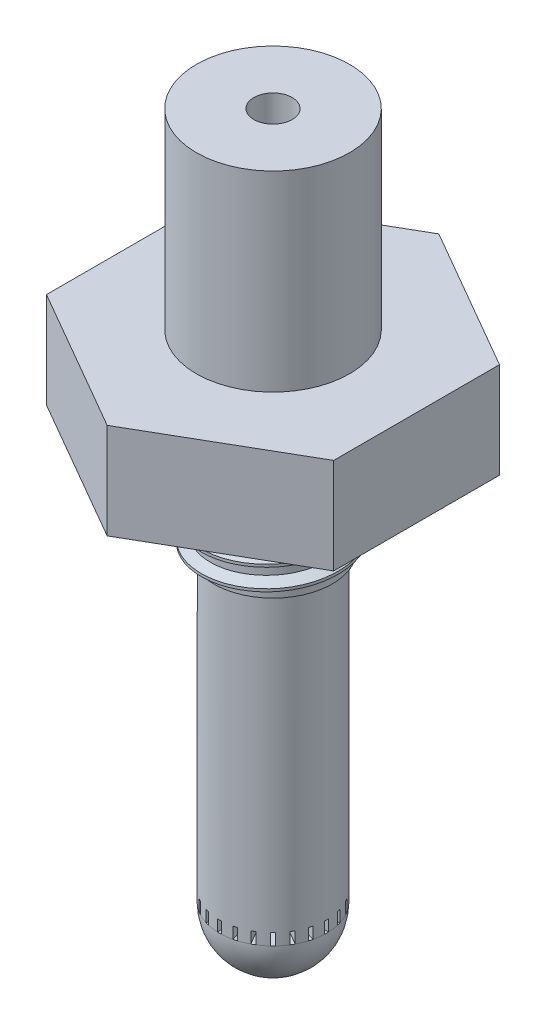
from build123d import *
from build123d.topology import SkipClean

# Parameters (mm, degrees)
CUT_EXTRUDE1_REACH  = 21.844
SKETCH2_W           = 0.254
SKETCH2_H           = 0.762
CIRPATTERN1_COUNT   = 24
BOSS_EXTRUDE1_START = -6.29158
SKETCH3_R           = 3.937
SKETCH3_R_2         = 1.27
BOSS_EXTRUDE1_DEPTH = 6.29158
BOSS_EXTRUDE2_START = 6.35
SKETCH4_R           = 1.27
BOSS_EXTRUDE2_DEPTH = 6.35
BOSS_EXTRUDE3_START = 12.7
SKETCH6_R           = 5.08
SKETCH6_R_2         = 1.27
BOSS_EXTRUDE3_DEPTH = 12.7
SWEEP1_PITCH        = 1.411111224
SKETCH9_W           = 5.029134959
SKETCH9_H           = 1.433756006


with BuildPart() as part:
    # Sketch1 → Revolve2 (revolve)
    with BuildSketch(Plane.XY, mode=Mode.PRIVATE) as revolve2_sk:
        with BuildLine():
            Line((-1.27, 18.181654136), (-3.556, 18.181654136))
            Line((-3.556, 18.181654136), (-3.556, -2.067225864))
            ThreePointArc((-3.556, -2.067225864), (-2.514471714, -4.581697578), (0, -5.623225864))
            Line((0, -5.623225864), (0, -1.606607061))
            ThreePointArc((0, -1.606607061), (-0.600006341, -1.9333996), (-1.27, -2.067225864))
            Line((-1.27, -2.067225864), (-1.27, 18.181654136))
        make_face()
    revolve(revolve2_sk.sketch.rotate(Axis((0, 8.215698649, 0), (0, -1, 0)), 270), axis=Axis((0, 8.215698649, 0), (0, -1, 0)))

    # Sketch2 → Cut-Extrude1 (cut, up to next)
    with BuildSketch(Plane.ZY.offset(3.556), mode=Mode.PRIVATE) as cut_extrude1_sk1:
        with Locations((0, -1.686225864)):
            Rectangle(SKETCH2_W, SKETCH2_H)
    cut_extrude1_tool1 = extrude(cut_extrude1_sk1.sketch, amount=-CUT_EXTRUDE1_REACH, mode=Mode.PRIVATE) & part.part
    cut_extrude1 = cut_extrude1_tool1.solids().sort_by_distance((-3.556, -1.686226, 0))[0]
    add(cut_extrude1, mode=Mode.SUBTRACT)

    # CirPattern1: Cut-Extrude1 ×24 about axis
    cirpattern1_axis = Axis((0, 0, 0), (0, 1, 0))
    for i in range(1, CIRPATTERN1_COUNT):
        add(cut_extrude1.rotate(cirpattern1_axis, i * 360 / CIRPATTERN1_COUNT), mode=Mode.SUBTRACT)

    # Sketch3 → Boss-Extrude1 (add)
    with BuildSketch(Plane(origin=(0, 18.181654136, 0), x_dir=(-1, 0, 0), z_dir=(0, -1, 0)).offset(BOSS_EXTRUDE1_START)):
        with Locations(Location((0, 0, 0), (0, 0, 90))):
            Circle(SKETCH3_R)
        with Locations(Location((0, 0, 0), (0, 0, 275.739170477))):
            Circle(SKETCH3_R_2, mode=Mode.SUBTRACT)
    extrude(amount=BOSS_EXTRUDE1_DEPTH)

    # Sketch4 → Boss-Extrude2 (add)
    with SkipClean():  # the faces are left unmerged after this step: merging them gives an invalid solid
        with BuildSketch(Plane(origin=(0, 24.473234136, 0), x_dir=(1, 0, 0), z_dir=(0, 1, 0)).offset(BOSS_EXTRUDE2_START)):
            Polygon((-9.525, 5.499261314), (-9.525, -5.499261314), (0, -10.998522628), (9.525, -5.499261314), (9.525, 5.499261314), (0, 10.998522628), align=None)
            with Locations(Location((0, 0, 0), (0, 0, 270))):
                Circle(SKETCH4_R, mode=Mode.SUBTRACT)
        extrude(amount=-BOSS_EXTRUDE2_DEPTH)

    # Sketch6 → Boss-Extrude3 (add)
    with BuildSketch(Plane(origin=(0, 30.823234136, 0), x_dir=(1, 0, 0), z_dir=(0, 1, 0)).offset(BOSS_EXTRUDE3_START)):
        with Locations(Location((0, 0, 0), (0, 0, 270))):
            Circle(SKETCH6_R)
        with Locations(Location((0, 0, 0), (0, 0, 270))):
            Circle(SKETCH6_R_2, mode=Mode.SUBTRACT)
    extrude(amount=-BOSS_EXTRUDE3_DEPTH)

    # Sweep1: the profile of Sketch8 profile screwed along a right-hand helix of 5 turns, 8 arcs to a turn; built about Z, then put on its axis
    sweep1_z = Axis((0, 0, 0), (0, 0, 1))
    sweep1_corners = [(3.9367, 0, -0.436648555), (3.9367, 0, 0.436648555), (4.54025, 0, 0.0881888), (4.54025, 0, -0.0881888)]
    with BuildLine(mode=Mode.PRIVATE) as sweep1_profile:
        Line(sweep1_corners[0], sweep1_corners[1])
        Line(sweep1_corners[1], sweep1_corners[2])
        Line(sweep1_corners[2], sweep1_corners[3])
        Line(sweep1_corners[3], sweep1_corners[0])
    sweep1_cap = Face(sweep1_profile.wire())
    sweep1_turn_angles = [0, 22.5, 45, 67.5, 90, 112.5, 135, 157.5, 180, 202.5, 225, 247.5, 270, 292.5, 315, 337.5, 360]
    sweep1_turn_weights = [1, 0.9238795325112867, 1, 0.9238795325112867, 1, 0.9238795325112867, 1, 0.9238795325112867, 1, 0.9238795325112867, 1, 0.9238795325112867, 1, 0.9238795325112867, 1, 0.9238795325112867, 1]
    sweep1_turn_rails = [Edge.make_bspline([Vector(p[0], p[1], 0).rotate(sweep1_z, sweep1_turn_angles[k]) / sweep1_turn_weights[k] + Vector(0, 0, p[2] + SWEEP1_PITCH * sweep1_turn_angles[k] / 360) for k in range(17)], [0, 0, 0, 1, 1, 2, 2, 3, 3, 4, 4, 5, 5, 6, 6, 7, 7, 8, 8, 8], 2, sweep1_turn_weights) for p in sweep1_corners]
    sweep1_turn_sides = [Face.make_surface_from_curves(sweep1_turn_rails[p[0]], sweep1_turn_rails[p[1]]) for p in [(0, 1), (1, 2), (2, 3), (3, 0)]]
    sweep1 = Plane(origin=(0, 18.181654136, 0), x_dir=(0, 0, -1), z_dir=(0, 1, 0)) * Solid(Shell([*[p.moved(Location((0, 0, SWEEP1_PITCH * i))) for i in range(5) for p in sweep1_turn_sides], sweep1_cap, sweep1_cap.rotate(sweep1_z, 1800).moved(Location((0, 0, SWEEP1_PITCH * 1800 / 360)))]))
    add(sweep1)

    # Sketch9 → Cut-Revolve2 (revolve, cut)
    with BuildSketch(Plane(origin=(0, 0, 0), x_dir=(0, 0, -1), z_dir=(1, 0, 0)), mode=Mode.PRIVATE) as cut_revolve2_sk:
        with Locations((6.284082913, 17.464776133)):
            Rectangle(SKETCH9_W, SKETCH9_H)
    revolve(cut_revolve2_sk.sketch.rotate(Axis((0, 0, 0), (0, 1, 0)), 90), axis=Axis((0, 0, 0), (0, 1, 0)), mode=Mode.SUBTRACT)


solid = part.part
